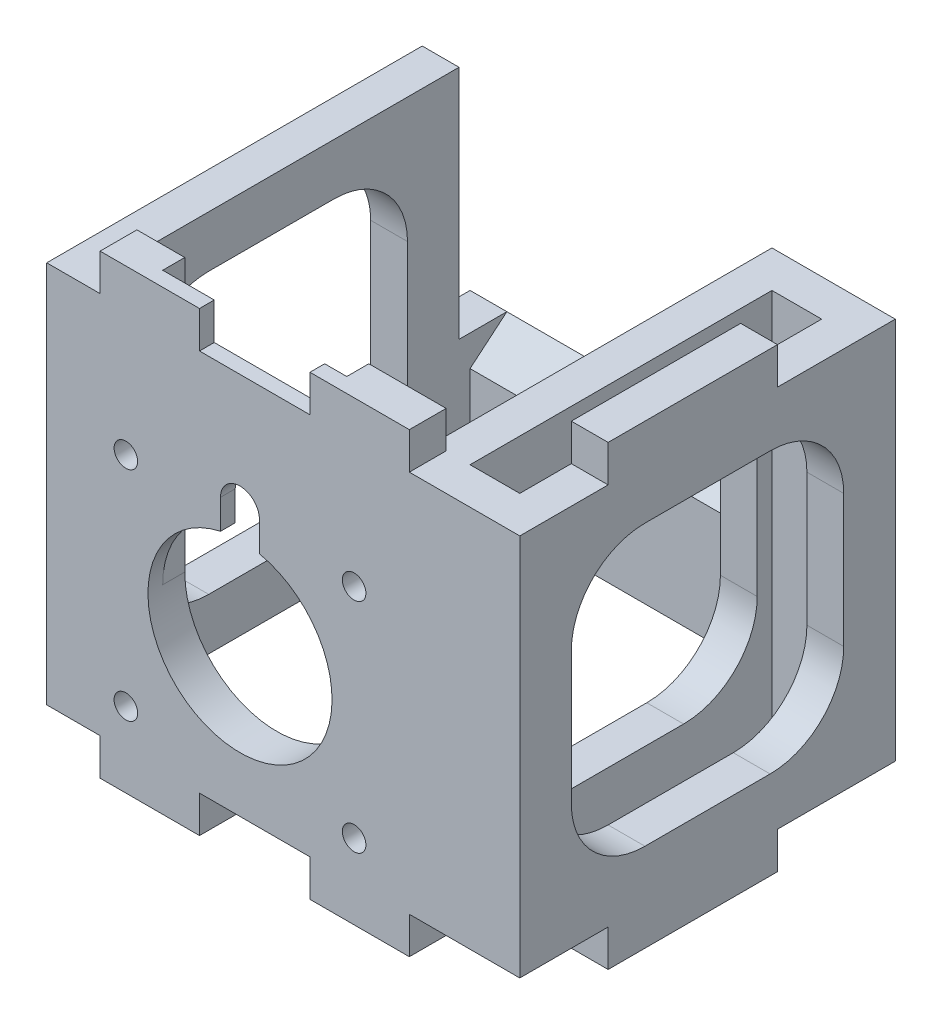
from build123d import *

# Parameters (mm, degrees)
ESQUISSE1_W                  = 52.5
ESQUISSE1_H                  = 57.5
ESQUISSE1_W_2                = 42.5
ESQUISSE1_H_2                = 47.5
EXTRU_MINCE1_DEPTH           = 20
ESQUISSE3_W                  = 6.75
ESQUISSE3_H                  = 41
ESQUISSE3_W_2                = 30.75
BOSS_EXTRU_1_DEPTH           = 52
ESQUISSE6_W                  = 5
ESQUISSE6_H                  = 23
ESQUISSE6_W_2                = 13.5
ESQUISSE6_H_2                = 5
BOSS_EXTRU_3_DEPTH           = 5
ENL_V_MAT_EXTRU_1_REACH      = 103.977
ESQUISSE2_R                  = 1.6
ENL_V_START                  = -3
ENL_V_MAT_EXTRU_2_DEPTH      = 3
ENL_V_MAT_EXTRU_3_DEPTH      = 119.640475808
ENL_V_MAT_EXTRU_4_DEPTH      = 99.458112921
ENL_V_MAT_EXTRU_5_DEPTH      = 89.991923791
ENL_V_MAT_EXTRU_5_DEPTH_BACK = 89.991923791
ESQUISSE10_W                 = 35.75
ESQUISSE10_H                 = 51
CHANFREIN1_SIZE2             = 4.195498156
CHANFREIN1_SIZE              = 5


with BuildPart() as part:
    # Esquisse1 → Extru.-Mince1 (new body)
    with BuildSketch(Plane(origin=(0, 0, 0), x_dir=(1, 0, 0), z_dir=(0, 1, 0))):
        Rectangle(ESQUISSE1_W, ESQUISSE1_H)
        Rectangle(ESQUISSE1_W_2, ESQUISSE1_H_2, mode=Mode.SUBTRACT)
    extrude(amount=EXTRU_MINCE1_DEPTH)

    # Esquisse3 → Boss.-Extru.1 (add)
    with BuildSketch(Plane.XZ):
        Polygon((26.25, 28.75), (38, 28.75), (38, -22.25), (21.25, -22.25), (21.25, 23.75), (-21.25, 23.75), (-21.25, -22.25), (-62, -22.25), (-62, 28.75), (-26.25, 28.75), (0, 28.75), align=None)
        with Locations((29.625, 3.25)):
            Rectangle(ESQUISSE3_W, ESQUISSE3_H, mode=Mode.SUBTRACT)
        with Locations((-41.625, 3.25)):
            Rectangle(ESQUISSE3_W_2, ESQUISSE3_H, mode=Mode.SUBTRACT)
    extrude(amount=-BOSS_EXTRU_1_DEPTH)

    # Esquisse6 → Boss.-Extru.3 (add)
    with BuildSketch(Plane(origin=(0, 52, 0), x_dir=(1, 0, 0), z_dir=(0, 1, 0))):
        with Locations((35.5, -5.25)):
            Rectangle(ESQUISSE6_W, ESQUISSE6_H)
        with Locations((16.25, -26.25)):
            Rectangle(ESQUISSE6_W_2, ESQUISSE6_H_2)
        with Locations((-12.25, -26.25)):
            Rectangle(ESQUISSE6_W_2, ESQUISSE6_H_2)
        with Locations((-40.75, -26.25)):
            Rectangle(ESQUISSE6_W_2, ESQUISSE6_H_2)
        with Locations((-40.75, 19.75)):
            Rectangle(ESQUISSE6_W_2, ESQUISSE6_H_2)
        with Locations((-59.5, -5.25)):
            Rectangle(ESQUISSE6_W, ESQUISSE6_H)
    boss_extru_3 = extrude(amount=BOSS_EXTRU_3_DEPTH)

    # Esquisse2 → Enlèv. mat.-Extru.1 (cut, up to next)
    with BuildSketch(Plane.XY.offset(28.75), mode=Mode.PRIVATE) as enl_v_mat_extru_1_sk1:
        with Locations((-15.5, 5.2)):
            Circle(ESQUISSE2_R)
    enl_v_mat_extru_1_tool1 = extrude(enl_v_mat_extru_1_sk1.sketch, amount=-ENL_V_MAT_EXTRU_1_REACH, mode=Mode.PRIVATE) & part.part
    # Esquisse2 → Enlèv. mat.-Extru.1 (cut, up to next)
    with BuildSketch(Plane.XY.offset(28.75), mode=Mode.PRIVATE) as enl_v_mat_extru_1_sk2:
        with Locations((15.5, 5.2)):
            Circle(ESQUISSE2_R)
    enl_v_mat_extru_1_tool2 = extrude(enl_v_mat_extru_1_sk2.sketch, amount=-ENL_V_MAT_EXTRU_1_REACH, mode=Mode.PRIVATE) & part.part
    # Esquisse2 → Enlèv. mat.-Extru.1 (cut, up to next)
    with BuildSketch(Plane.XY.offset(28.75), mode=Mode.PRIVATE) as enl_v_mat_extru_1_sk3:
        with Locations(Location((15.5, 34.8, 0), (0, 0, 180))):
            Circle(ESQUISSE2_R)
    enl_v_mat_extru_1_tool3 = extrude(enl_v_mat_extru_1_sk3.sketch, amount=-ENL_V_MAT_EXTRU_1_REACH, mode=Mode.PRIVATE) & part.part
    # Esquisse2 → Enlèv. mat.-Extru.1 (cut, up to next)
    with BuildSketch(Plane.XY.offset(28.75), mode=Mode.PRIVATE) as enl_v_mat_extru_1_sk4:
        with Locations(Location((-15.5, 34.8, 0), (0, 0, 180))):
            Circle(ESQUISSE2_R)
    enl_v_mat_extru_1_tool4 = extrude(enl_v_mat_extru_1_sk4.sketch, amount=-ENL_V_MAT_EXTRU_1_REACH, mode=Mode.PRIVATE) & part.part
    # Esquisse2 → Enlèv. mat.-Extru.1 (cut, up to next)
    with BuildSketch(Plane.XY.offset(28.75), mode=Mode.PRIVATE) as enl_v_mat_extru_1_sk5:
        with BuildLine():
            Line((2.65, 36.215870824), (2.65, 32.215870824))
            ThreePointArc((2.65, 32.215870824), (0, 7.5), (-2.65, 32.215870824))
            Line((-2.65, 32.215870824), (-2.65, 36.215870824))
            ThreePointArc((-2.65, 36.215870824), (0, 38.865870824), (2.65, 36.215870824))
        make_face()
    enl_v_mat_extru_1_tool5 = extrude(enl_v_mat_extru_1_sk5.sketch, amount=-ENL_V_MAT_EXTRU_1_REACH, mode=Mode.PRIVATE) & part.part
    add(enl_v_mat_extru_1_tool1.solids().sort_by_distance((-15.5, 5.2, 28.75))[0], mode=Mode.SUBTRACT)
    add(enl_v_mat_extru_1_tool2.solids().sort_by_distance((15.5, 5.2, 28.75))[0], mode=Mode.SUBTRACT)
    add(enl_v_mat_extru_1_tool3.solids().sort_by_distance((15.5, 34.8, 28.75))[0], mode=Mode.SUBTRACT)
    add(enl_v_mat_extru_1_tool4.solids().sort_by_distance((-15.5, 34.8, 28.75))[0], mode=Mode.SUBTRACT)
    add(enl_v_mat_extru_1_tool5.solids().sort_by_distance((0, 20.91985, 28.75))[0], mode=Mode.SUBTRACT)

    # Esquisse4 → Enlèv. mat.-Extru.2 (cut)
    with BuildSketch(Plane(origin=(0, 0, 23.75), x_dir=(-1, 0, 0), z_dir=(0, 0, -1)).offset(ENL_V_START)):
        with BuildLine():
            Line((-12.5, 20), (-12.5, 57))
            Line((-12.5, 57), (12.5, 57))
            Line((12.5, 57), (12.5, 20))
            ThreePointArc((12.5, 20), (0, 32.5), (-12.5, 20))
        make_face()
    extrude(amount=ENL_V_MAT_EXTRU_2_DEPTH, mode=Mode.SUBTRACT)

    # Symétrie1: Boss.-Extru.3 across plane
    add(boss_extru_3.mirror(Plane(origin=(0, 26, 0), x_dir=(0, 0, 1), z_dir=(0, -1, 0))))

    # Esquisse7 → Enlèv. mat.-Extru.3 (cut, through all)
    with BuildSketch(Plane(origin=(38, 0, 0), x_dir=(0, 0, -1), z_dir=(1, 0, 0))):
        with BuildLine():
            Line((-11.75, 45), (5.25, 45))
            ThreePointArc((5.25, 45), (12.321067812, 42.071067812), (15.25, 35))
            Line((15.25, 35), (15.25, 17))
            ThreePointArc((15.25, 17), (12.321067812, 9.928932188), (5.25, 7))
            Line((5.25, 7), (-11.75, 7))
            ThreePointArc((-11.75, 7), (-18.821067812, 9.928932188), (-21.75, 17))
            Line((-21.75, 17), (-21.75, 35))
            ThreePointArc((-21.75, 35), (-18.821067812, 42.071067812), (-11.75, 45))
        make_face()
    extrude(amount=-ENL_V_MAT_EXTRU_3_DEPTH, mode=Mode.SUBTRACT)

    # Esquisse8 → Enlèv. mat.-Extru.4 (cut, through all)
    with BuildSketch(Plane(origin=(0, 0, -22.25), x_dir=(-1, 0, 0), z_dir=(0, 0, -1))):
        with BuildLine():
            Line((48.625, 33.5), (48.625, 18.5))
            ThreePointArc((48.625, 18.5), (41.625, 11.5), (34.625, 18.5))
            Line((34.625, 18.5), (34.625, 33.5))
            ThreePointArc((34.625, 33.5), (41.625, 40.5), (48.625, 33.5))
        make_face()
    extrude(amount=-ENL_V_MAT_EXTRU_4_DEPTH, mode=Mode.SUBTRACT)

    # Esquisse10 → Enlèv. mat.-Extru.5 (cut, two sides: drawn at the far end of the back side and taken through both)
    with BuildSketch(Plane(origin=(0, 52, 0), x_dir=(1, 0, 0), z_dir=(0, 1, 0)).offset(-ENL_V_MAT_EXTRU_5_DEPTH_BACK)):
        with Locations((-44.125, -3.25)):
            Rectangle(ESQUISSE10_W, ESQUISSE10_H)
    extrude(amount=ENL_V_MAT_EXTRU_5_DEPTH + ENL_V_MAT_EXTRU_5_DEPTH_BACK, mode=Mode.SUBTRACT)

    # Chanfrein1
    chanfrein1_edges = [part.edges().sort_by_distance(p)[0] for p in [
        (0, 20, -23.75),
    ]]
    chanfrein1_side = [part.faces().sort_by_distance(p)[0] for p in [
        (0, 20, -23.833909963),
    ]]
    chamfer(chanfrein1_edges, length=CHANFREIN1_SIZE - 0.0001, length2=CHANFREIN1_SIZE2 - 0.0001, reference=chanfrein1_side[0])  # a hair under: the kernel refuses the full size


solid = part.part
